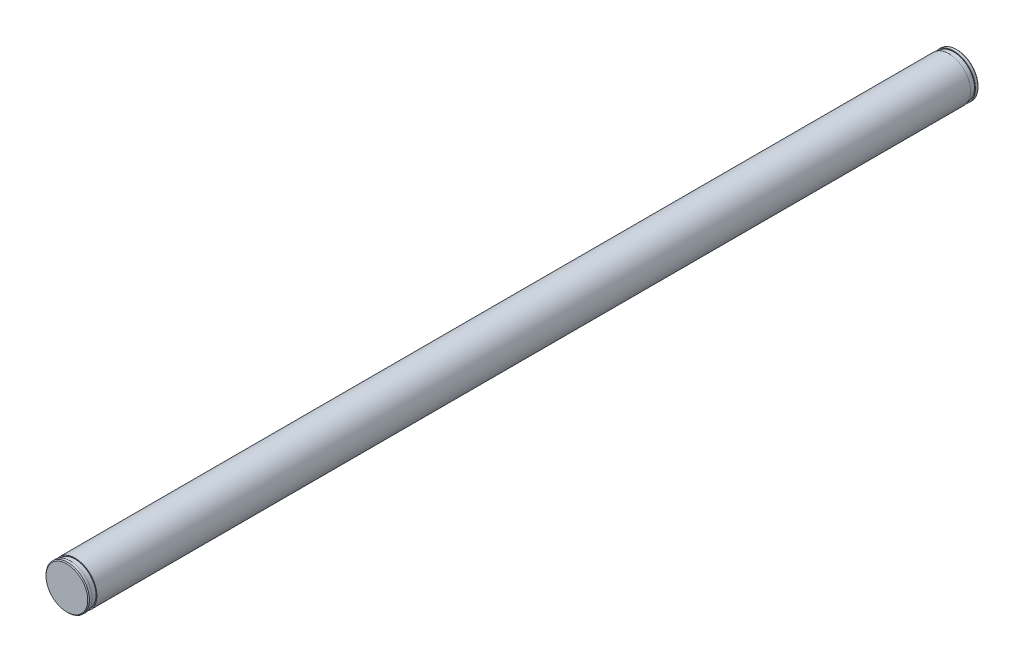
from build123d import *

# Parameters (mm, degrees)
FASE1_SIZE = 0.2


with BuildPart() as part:
    # Skizze7 → Rotation1 (revolve)
    with BuildSketch(Plane(origin=(0, 0, 0), x_dir=(0, 0, -1), z_dir=(1, 0, 0))):
        Polygon((-204, 5), (-204, 4.8), (-202.9, 4.8), (-202.9, 5), (-1.9, 5), (-1.9, 4.8), (-0.8, 4.8), (-0.8, 5), (0, 5), (0, 0), (-204.8, 0), (-204.8, 5), align=None)
    revolve(axis=Axis((0, 0, 204.8), (0, 0, -1)))

    # Fase1
    fase1_edges = [part.edges().sort_by_distance(p)[0] for p in [
        (0, -5, 0),
        (0, -5, 204.8),
    ]]
    chamfer(fase1_edges, length=FASE1_SIZE)


solid = part.part
